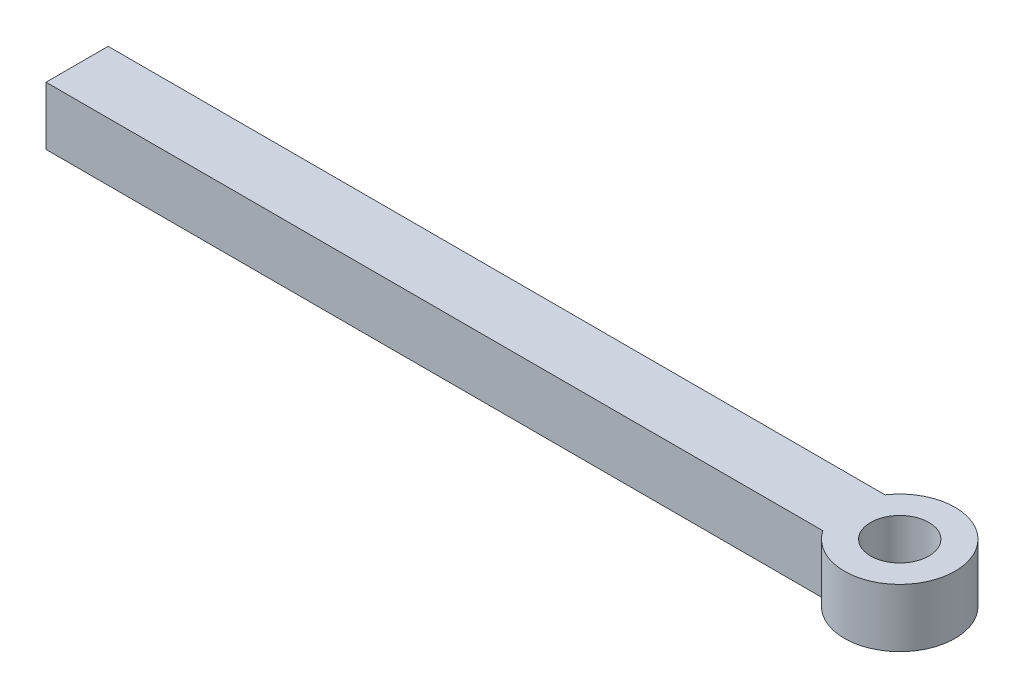
from build123d import *

# Parameters (mm, degrees)
RESSALTO_EXTRUS_O1_DEPTH = 15
ESBO_O3_R                = 7.5
CORTE_EXTRUS_O2_DEPTH    = 228.629663365
ESBO_O4_R                = 4
CORTE_EXTRUS_O3_DEPTH    = 30


with BuildPart() as part:
    # Esboço1 → Ressalto-extrusão1 (new body)
    with BuildSketch(Plane(origin=(0, 0, 0), x_dir=(1, 0, 0), z_dir=(0, 1, 0))):
        with BuildLine():
            Line((0, 16), (200, 16))
            ThreePointArc((200, 16), (226.042476415, 8), (200, 0))
            Line((200, 0), (0, 0))
            Line((0, 0), (0, 16))
        make_face()
    extrude(amount=RESSALTO_EXTRUS_O1_DEPTH)

    # Esboço3 → Corte-extrusão2 (cut, through all)
    with BuildSketch(Plane(origin=(0, 15, 0), x_dir=(1, 0, 0), z_dir=(0, 1, 0))):
        with Locations((211.792476415, 8)):
            Circle(ESBO_O3_R)
    extrude(amount=-CORTE_EXTRUS_O2_DEPTH, mode=Mode.SUBTRACT)

    # Esboço4 → Corte-extrusão3 (cut)
    with BuildSketch(Plane.ZY):
        with Locations((-8, 7.5)):
            Circle(ESBO_O4_R)
    extrude(amount=-CORTE_EXTRUS_O3_DEPTH, mode=Mode.SUBTRACT)


solid = part.part
